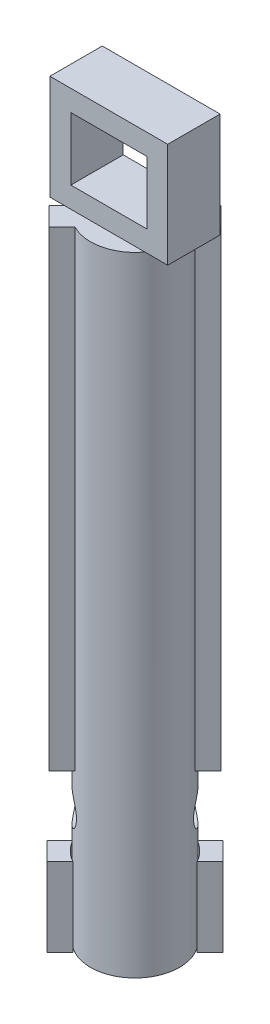
from build123d import *

# Parameters (mm, degrees)
SKETCH1_R             = 1.7
BOSS_EXTRUDE1_DEPTH   = 12
BOSS_EXTRUDE2_DEPTH   = 18
BOSS_EXTRUDE3_DEPTH   = 3
BOSS_EXTRUDE3_2_DEPTH = 3
SKETCH10_W            = 4.5
SKETCH10_H            = 2
BOSS_EXTRUDE4_DEPTH   = 4
SKETCH11_W            = 2.9
SKETCH11_H            = 2.4
CUT_EXTRUDE1_DEPTH    = 17.439889772
SKETCH12_W            = 0.625
SKETCH12_H            = 5.328201779


with BuildPart() as part:
    # Sketch1 → Boss-Extrude1 (new, symmetric)
    with BuildSketch(Plane(origin=(0, 0, 0), x_dir=(1, 0, 0), z_dir=(0, 1, 0))):
        Circle(SKETCH1_R)
    extrude(amount=BOSS_EXTRUDE1_DEPTH, both=True)

    # Sketch2 → Boss-Extrude2 (add)
    with BuildSketch(Plane(origin=(0, 12, 0), x_dir=(1, 0, 0), z_dir=(0, 1, 0))):
        with BuildLine():
            Line((-0.795359139, -1.50246592), (-1.290333886, -1.997440667))
            Line((-1.290333886, -1.997440667), (-1.997440667, -1.290333886))
            Line((-1.997440667, -1.290333886), (-1.50246592, -0.795359139))
            ThreePointArc((-1.50246592, -0.795359139), (-1.202081528, -1.202081528), (-0.795359139, -1.50246592))
        make_face()
        with BuildLine():
            Line((1.290333886, 1.997440667), (0.795359139, 1.50246592))
            ThreePointArc((0.795359139, 1.50246592), (1.202081528, 1.202081528), (1.50246592, 0.795359139))
            Line((1.50246592, 0.795359139), (1.997440667, 1.290333886))
            Line((1.997440667, 1.290333886), (1.290333886, 1.997440667))
        make_face()
    extrude(amount=-BOSS_EXTRUDE2_DEPTH)

    # Sketch10 → Boss-Extrude4 (add)
    with BuildSketch(Plane(origin=(0, 12, 0), x_dir=(1, 0, 0), z_dir=(0, 1, 0))):
        Rectangle(SKETCH10_W, SKETCH10_H)
    extrude(amount=BOSS_EXTRUDE4_DEPTH)

    # Sketch11 → Cut-Extrude1 (cut, through all)
    with BuildSketch(Plane.XY.offset(-1)):
        with Locations((0, 14)):
            Rectangle(SKETCH11_W, SKETCH11_H)
    extrude(amount=CUT_EXTRUDE1_DEPTH, mode=Mode.SUBTRACT)

    # Sketch12 → M1.6 Tapped Hole4 (revolve, cut)
    with BuildSketch(Plane(origin=(-1.643887276, -7.5, 1.643887276), x_dir=(0.7071067811865568, 0, 0.7071067811865384), z_dir=(0, 1, 0))):
        with Locations((0.3125, 2.66410089)):
            Rectangle(SKETCH12_W, SKETCH12_H)
    revolve(axis=Axis((-6.134015337, -7.5, 6.134015337), (0.7071067811865384, 0, -0.7071067811865568)), mode=Mode.SUBTRACT)


with BuildPart() as body_2:
    # Sketch7 → Boss-Extrude3 (new body)
    with BuildSketch(Plane.XZ.offset(12)):
        with BuildLine():
            Line((2.03438226, -1.327275479), (1.539407513, -0.832300732))
            ThreePointArc((1.539407513, -0.832300732), (1.237436867, -1.237436867), (0.832300732, -1.539407513))
            Line((0.832300732, -1.539407513), (1.327275479, -2.03438226))
            Line((1.327275479, -2.03438226), (2.03438226, -1.327275479))
        make_face()
    extrude(amount=-BOSS_EXTRUDE3_DEPTH)


with BuildPart() as body_3:
    # Sketch7 → Boss-Extrude3 2 (new body)
    with BuildSketch(Plane.XZ.offset(12)):
        with BuildLine():
            Line((-2.03438226, 1.327275479), (-1.539407513, 0.832300732))
            ThreePointArc((-1.539407513, 0.832300732), (-1.237436867, 1.237436867), (-0.832300732, 1.539407513))
            Line((-0.832300732, 1.539407513), (-1.327275479, 2.03438226))
            Line((-1.327275479, 2.03438226), (-2.03438226, 1.327275479))
        make_face()
    extrude(amount=-BOSS_EXTRUDE3_2_DEPTH)


solid = Compound([part.part, body_2.part, body_3.part])
